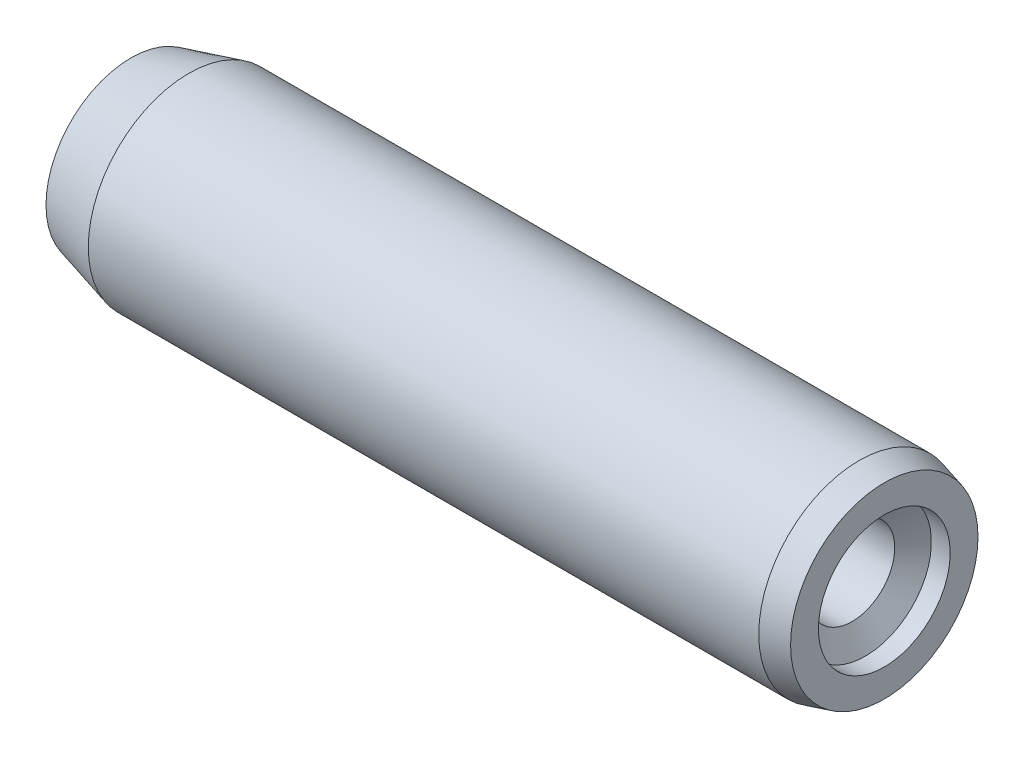
from build123d import *


with BuildPart() as part:
    # BodySke → Body (revolve)
    with BuildSketch(Plane.XY):
        Polygon((4.6, 8), (58, 8), (60, 7.464101615), (60, 5.25), (58.5, 5.25), (57.431902002, 3.4), (35, 3.4), (33.591673888, 0), (0, 0), (0, 6.767433715), align=None)
    revolve(axis=Axis((0, 0, 0), (1, 0, 0)))


solid = part.part
